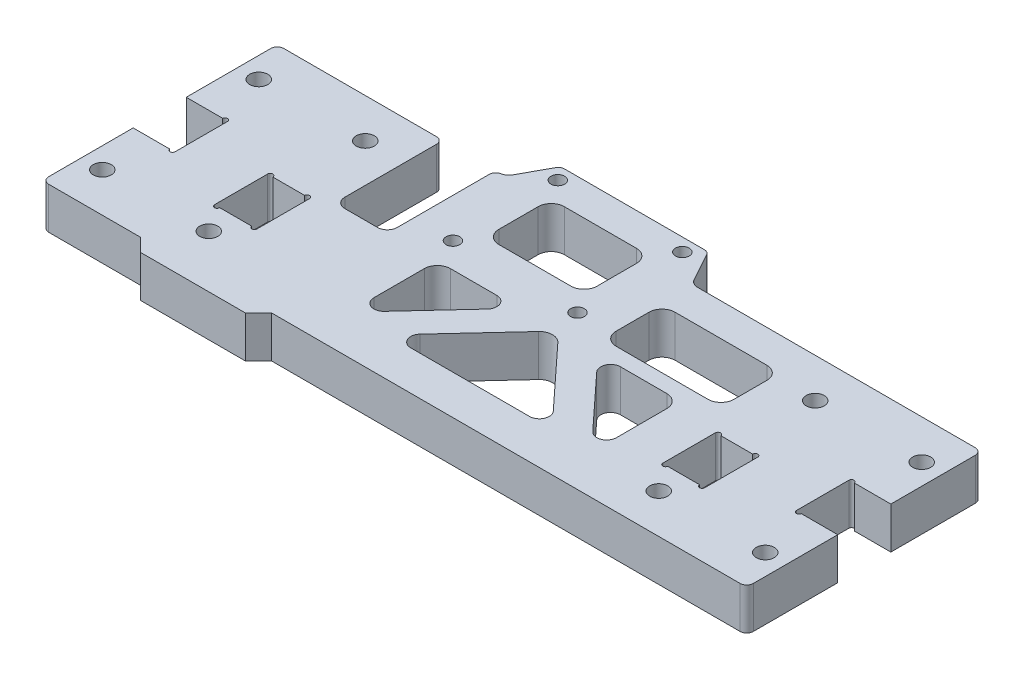
from build123d import *

# Parameters (mm, degrees)
SKETCH1_R           = 2.75
BOSS_EXTRUDE1_DEPTH = 12.7
SKETCH2_W           = 16
SKETCH2_H           = 46.496113018
CUT_EXTRUDE1_DEPTH  = 231.724624824
SKETCH3_R           = 2.1
CUT_EXTRUDE2_DEPTH  = 231.724624824
CUT_EXTRUDE3_DEPTH  = 231.724624824
FILLET1_R           = 3
FILLET2_R           = 2


with BuildPart() as part:
    # Sketch1 → Boss-Extrude1 (new body)
    with BuildSketch(Plane(origin=(0, 0, 0), x_dir=(1, 0, 0), z_dir=(0, 1, 0))):
        with BuildLine():
            Line((0, 71.75), (69.5, 71.75))
            Line((69.5, 71.75), (75.5, 82.75))
            Line((75.5, 82.75), (120.5, 82.75))
            Line((120.5, 82.75), (126.5, 71.75))
            Line((126.5, 71.75), (215, 71.75))
            Line((215, 71.75), (215, 43.975))
            Line((215, 43.975), (203.881088693, 43.975))
            ThreePointArc((203.881088693, 43.975), (203.090544346, 44.652363805), (202.3, 43.975))
            Line((202.3, 43.975), (202.3, 27.775))
            ThreePointArc((202.3, 27.775), (203.090544346, 27.097636195), (203.881088693, 27.775))
            Line((203.881088693, 27.775), (215, 27.775))
            Line((215, 27.775), (215, 0))
            Line((215, 0), (70, 0))
            Line((70, 0), (66, -4))
            Line((66, -4), (34, -4))
            Line((34, -4), (30, 0))
            Line((30, 0), (0, 0))
            Line((0, 0), (0, 27.775))
            Line((0, 27.775), (11.118911307, 27.775))
            ThreePointArc((11.118911307, 27.775), (11.909455654, 27.097636195), (12.7, 27.775))
            Line((12.7, 27.775), (12.7, 43.975))
            ThreePointArc((12.7, 43.975), (11.909455654, 44.652363805), (11.118911307, 43.975))
            Line((11.118911307, 43.975), (0, 43.975))
            Line((0, 43.975), (0, 71.75))
        make_face()
        with Locations((38.85, 59.75)):
            Circle(SKETCH1_R, mode=Mode.SUBTRACT)
        with Locations((38.85, 12)):
            Circle(SKETCH1_R, mode=Mode.SUBTRACT)
        with Locations((176.15, 59.75)):
            Circle(SKETCH1_R, mode=Mode.SUBTRACT)
        with Locations((176.15, 12)):
            Circle(SKETCH1_R, mode=Mode.SUBTRACT)
        with Locations((6.35, 12)):
            Circle(SKETCH1_R, mode=Mode.SUBTRACT)
        with Locations((6.35, 59.75)):
            Circle(SKETCH1_R, mode=Mode.SUBTRACT)
        with Locations((208.65, 59.75)):
            Circle(SKETCH1_R, mode=Mode.SUBTRACT)
        with Locations((208.65, 12)):
            Circle(SKETCH1_R, mode=Mode.SUBTRACT)
        with BuildLine():
            Line((32.700387603, 36.1), (32.700387603, 19.9))
            ThreePointArc((32.700387603, 19.9), (33.500387603, 19.1), (34.300387603, 19.9))
            Line((34.300387603, 19.9), (44.006274607, 19.9))
            ThreePointArc((44.006274607, 19.9), (44.85009833, 19.201570193), (45.6, 20))
            Line((45.6, 20), (45.6, 36))
            ThreePointArc((45.6, 36), (44.85009833, 36.798429807), (44.006274607, 36.1))
            Line((44.006274607, 36.1), (34.300387603, 36.1))
            ThreePointArc((34.300387603, 36.1), (33.500387603, 36.9), (32.700387603, 36.1))
        make_face(mode=Mode.SUBTRACT)
        with BuildLine():
            Line((182.299612397, 36.1), (182.299612397, 19.9))
            ThreePointArc((182.299612397, 19.9), (181.499612397, 19.1), (180.699612397, 19.9))
            Line((180.699612397, 19.9), (170.993725393, 19.9))
            ThreePointArc((170.993725393, 19.9), (170.14990167, 19.201570193), (169.4, 20))
            Line((169.4, 20), (169.4, 36))
            ThreePointArc((169.4, 36), (170.14990167, 36.798429807), (170.993725393, 36.1))
            Line((170.993725393, 36.1), (180.699612397, 36.1))
            ThreePointArc((180.699612397, 36.1), (181.499612397, 36.9), (182.299612397, 36.1))
        make_face(mode=Mode.SUBTRACT)
    extrude(amount=BOSS_EXTRUDE1_DEPTH)

    # Sketch2 → Cut-Extrude1 (cut, through all)
    with BuildSketch(Plane(origin=(0, 12.7, 0), x_dir=(1, 0, 0), z_dir=(0, 1, 0))):
        with Locations((58.6, 61.998056509)):
            Rectangle(SKETCH2_W, SKETCH2_H)
    extrude(amount=-CUT_EXTRUDE1_DEPTH, mode=Mode.SUBTRACT)

    # Sketch3 → Cut-Extrude2 (cut, through all)
    with BuildSketch(Plane(origin=(0, 12.7, 0), x_dir=(1, 0, 0), z_dir=(0, 1, 0))):
        with Locations((78.6, 78.75)):
            Circle(SKETCH3_R)
        with Locations((78.6, 46.75)):
            Circle(SKETCH3_R)
        with Locations((116.6, 78.75)):
            Circle(SKETCH3_R)
        with Locations((116.6, 46.75)):
            Circle(SKETCH3_R)
    extrude(amount=-CUT_EXTRUDE2_DEPTH, mode=Mode.SUBTRACT)

    # Sketch5 → Cut-Extrude3 (cut, through all)
    with BuildSketch(Plane(origin=(0, 12.7, 0), x_dir=(1, 0, 0), z_dir=(0, 1, 0))):
        with BuildLine():
            Line((86.801282022, 17.617384584), (101.93497769, 33.961775906))
            ThreePointArc((101.93497769, 33.961775906), (102.482756625, 37.201109428), (99.733695668, 39))
            Line((99.733695668, 39), (85.6, 39))
            ThreePointArc((85.6, 39), (82.771572875, 37.828427125), (81.6, 35))
            Line((81.6, 35), (81.6, 19.655608678))
            ThreePointArc((81.6, 19.655608678), (83.505432977, 16.862416413), (86.801282022, 17.617384584))
        make_face()
        with BuildLine():
            Line((115.664957304, 35.830153888), (98.26502231, 17.038224094))
            ThreePointArc((98.26502231, 17.038224094), (97.717243375, 13.798890572), (100.466304332, 12))
            Line((100.466304332, 12), (136.733695668, 12))
            ThreePointArc((136.733695668, 12), (139.482756625, 13.798890572), (138.93497769, 17.038224094))
            Line((138.93497769, 17.038224094), (121.535042696, 35.830153888))
            ThreePointArc((121.535042696, 35.830153888), (118.6, 37.112521762), (115.664957304, 35.830153888))
        make_face()
        with BuildLine():
            Line((137.466304332, 39), (151.6, 39))
            ThreePointArc((151.6, 39), (154.428427125, 37.828427125), (155.6, 35))
            Line((155.6, 35), (155.6, 19.655608678))
            ThreePointArc((155.6, 19.655608678), (153.694567023, 16.862416413), (150.398717978, 17.617384584))
            Line((150.398717978, 17.617384584), (135.26502231, 33.961775906))
            ThreePointArc((135.26502231, 33.961775906), (134.717243375, 37.201109428), (137.466304332, 39))
        make_face()
        with BuildLine():
            Line((86.6, 72.75), (108.6, 72.75))
            ThreePointArc((108.6, 72.75), (111.428427125, 71.578427125), (112.6, 68.75))
            Line((112.6, 68.75), (112.6, 56.75))
            ThreePointArc((112.6, 56.75), (111.428427125, 53.921572875), (108.6, 52.75))
            Line((108.6, 52.75), (86.6, 52.75))
            ThreePointArc((86.6, 52.75), (83.771572875, 53.921572875), (82.6, 56.75))
            Line((82.6, 56.75), (82.6, 68.75))
            ThreePointArc((82.6, 68.75), (83.771572875, 71.578427125), (86.6, 72.75))
        make_face()
        with BuildLine():
            Line((131.4, 61.75), (159.4, 61.75))
            ThreePointArc((159.4, 61.75), (162.228427125, 60.578427125), (163.4, 57.75))
            Line((163.4, 57.75), (163.4, 47.75))
            ThreePointArc((163.4, 47.75), (162.228427125, 44.921572875), (159.4, 43.75))
            Line((159.4, 43.75), (131.4, 43.75))
            ThreePointArc((131.4, 43.75), (128.571572875, 44.921572875), (127.4, 47.75))
            Line((127.4, 47.75), (127.4, 57.75))
            ThreePointArc((127.4, 57.75), (128.571572875, 60.578427125), (131.4, 61.75))
        make_face()
    extrude(amount=-CUT_EXTRUDE3_DEPTH, mode=Mode.SUBTRACT)

    # Fillet1
    fillet1_edges = [part.edges().sort_by_distance(p)[0] for p in [
        (69.5, 6.35, -71.75),
        (66.6, 6.35, -38.75),
        (50.6, 6.35, -38.75),
        (126.5, 6.35, -71.75),
    ]]
    fillet(fillet1_edges, radius=FILLET1_R)

    # Fillet2
    fillet2_edges = [part.edges().sort_by_distance(p)[0] for p in [
        (215, 6.35, -71.75),
        (120.5, 6.35, -82.75),
        (75.5, 6.35, -82.75),
        (50.6, 6.35, -71.75),
        (66.6, 6.35, -71.75),
        (0, 6.35, -71.75),
        (215, 6.35, 0),
        (0, 6.35, 0),
    ]]
    fillet(fillet2_edges, radius=FILLET2_R)


solid = part.part
